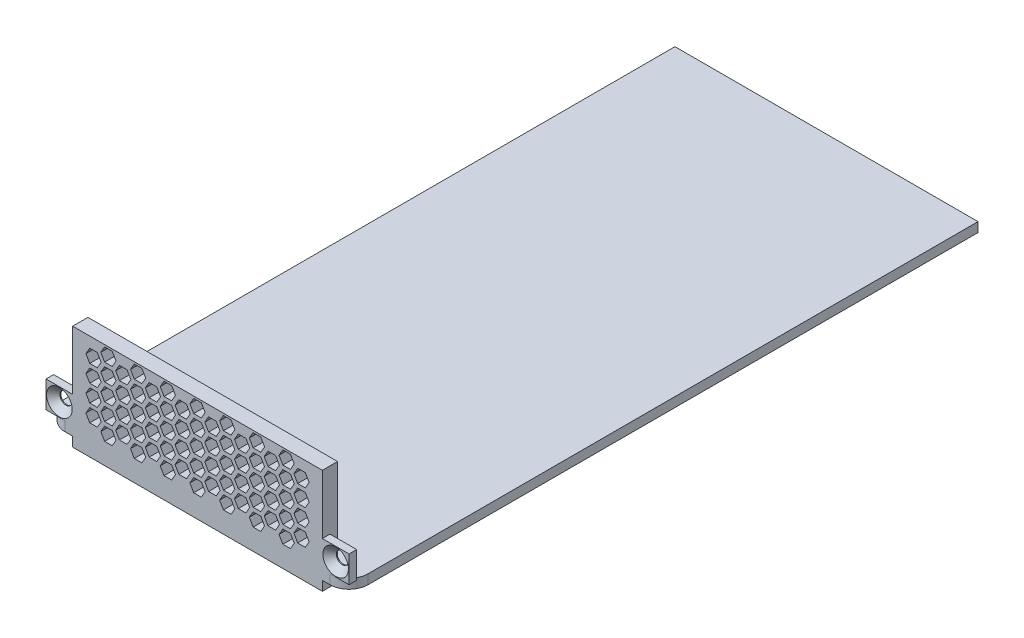
from build123d import *

# Parameters (mm, degrees)
BOSS_EXTRUDE1_DEPTH                                  = 165
FILLET1_R                                            = 5
SKETCH3_W                                            = 65.5
SKETCH3_H                                            = 22.5
BOSS_EXTRUDE2_DEPTH                                  = 4
FILL_START                                           = -4
FILL_PATTERN1_DEPTH                                  = 4
SKETCH4_W                                            = 10
SKETCH4_H                                            = 5
BOSS_EXTRUDE3_DEPTH                                  = 2
SKETCH7_W                                            = 7
SKETCH7_H                                            = 7
BOSS_EXTRUDE4_DEPTH                                  = 2
SKETCH9_W                                            = 7
SKETCH9_H                                            = 7
BOSS_EXTRUDE5_DEPTH                                  = 2
CSK_FOR_M3_HEX_SOCKET_COUNTERSUNK_CAP_SC_D           = 3.2
CSK_FOR_M3_HEX_SOCKET_COUNTERSUNK_CAP_SC_DEPTH       = 5.03862301
CSK_FOR_M3_HEX_SOCKET_COUNTERSUNK_CAP_SC_CSINK_D     = 6.72
CSK_FOR_M3_HEX_SOCKET_COUNTERSUNK_CAP_SC_CSINK_ANGLE = 90
CSK_FOR_M3_HEX_SOCKET_COUNTERSUNK_CAP_SC_TIP         = 0.96137699


# Read off the part's stored shape, not the designer's step: Fill Pattern1
with BuildPart() as part:
    # Sketch1 → Boss-Extrude1 (new body)
    with BuildSketch(Plane.XY):
        Polygon((-39.75, 0), (39.75, 0), (39.75, -2.5), (32.75, -2.5), (32.75, -5), (-32.75, -5), (-32.75, -2.5), (-39.75, -2.5), align=None)
    extrude(amount=-BOSS_EXTRUDE1_DEPTH)

    # Fillet1
    fillet1_edges = [part.edges().sort_by_distance(p)[0] for p in [
        (-39.75, -1.25, 0),
        (39.75, -1.25, 0),
    ]]
    fillet(fillet1_edges, radius=FILLET1_R)

    # Sketch4 → Boss-Extrude3 (add)
    with BuildSketch(Plane.XZ.offset(5)):
        with Locations((0, -7.5)):
            Rectangle(SKETCH4_W, SKETCH4_H)
    extrude(amount=BOSS_EXTRUDE3_DEPTH)



with BuildPart() as body_2:
    # Sketch3 → Boss-Extrude2 (new body)
    with BuildSketch(Plane.XY):
        with Locations((0, 11.25)):
            Rectangle(SKETCH3_W, SKETCH3_H)
    extrude(amount=-BOSS_EXTRUDE2_DEPTH)

    # Fill Pattern1 outline → Fill Pattern1 (cut)
    with BuildSketch(Plane.XY.offset(FILL_START)):
        Polygon((-24.382685902, 3.982050808), (-25.382685902, 2.25), (-24.382685902, 0.517949192), (-22.382685902, 0.517949192), (-21.382685902, 2.25), (-22.382685902, 3.982050808), align=None)
        Polygon((-20.485571585, 10.732050808), (-21.485571585, 9), (-20.485571585, 7.267949192), (-18.485571585, 7.267949192), (-17.485571585, 9), (-18.485571585, 10.732050808), align=None)
        Polygon((-16.588457268, 17.482050808), (-17.588457268, 15.75), (-16.588457268, 14.017949192), (-14.588457268, 14.017949192), (-13.588457268, 15.75), (-14.588457268, 17.482050808), align=None)
        Polygon((-14.588457268, 3.982050808), (-16.588457268, 3.982050808), (-17.588457268, 2.25), (-16.588457268, 0.517949192), (-14.588457268, 0.517949192), (-13.588457268, 2.25), align=None)
        Polygon((-6.794228634, 3.982050808), (-8.794228634, 3.982050808), (-9.794228634, 2.25), (-8.794228634, 0.517949192), (-6.794228634, 0.517949192), (-5.794228634, 2.25), align=None)
        Polygon((1, 3.982050808), (-1, 3.982050808), (-2, 2.25), (-1, 0.517949192), (1, 0.517949192), (2, 2.25), align=None)
        Polygon((8.794228634, 3.982050808), (6.794228634, 3.982050808), (5.794228634, 2.25), (6.794228634, 0.517949192), (8.794228634, 0.517949192), (9.794228634, 2.25), align=None)
        Polygon((24.382685902, 3.982050808), (22.382685902, 3.982050808), (21.382685902, 2.25), (22.382685902, 0.517949192), (24.382685902, 0.517949192), (25.382685902, 2.25), align=None)
        Polygon((16.588457268, 3.982050808), (14.588457268, 3.982050808), (13.588457268, 2.25), (14.588457268, 0.517949192), (16.588457268, 0.517949192), (17.588457268, 2.25), align=None)
        Polygon((-25.279800219, 9), (-26.279800219, 10.732050808), (-28.279800219, 10.732050808), (-29.279800219, 9), (-28.279800219, 7.267949192), (-26.279800219, 7.267949192), align=None)
        Polygon((-8.794228634, 21.982050808), (-9.794228634, 20.25), (-8.794228634, 18.517949192), (-6.794228634, 18.517949192), (-5.794228634, 20.25), (-6.794228634, 21.982050808), align=None)
        Polygon((-16.588457268, 8.482050808), (-17.588457268, 6.75), (-16.588457268, 5.017949192), (-14.588457268, 5.017949192), (-13.588457268, 6.75), (-14.588457268, 8.482050808), align=None)
        Polygon((-12.691342951, 15.232050808), (-13.691342951, 13.5), (-12.691342951, 11.767949192), (-10.691342951, 11.767949192), (-9.691342951, 13.5), (-10.691342951, 15.232050808), align=None)
        Polygon((-14.588457268, 21.982050808), (-16.588457268, 21.982050808), (-17.588457268, 20.25), (-16.588457268, 18.517949192), (-14.588457268, 18.517949192), (-13.588457268, 20.25), align=None)
        Polygon((24.382685902, 21.982050808), (22.382685902, 21.982050808), (21.382685902, 20.25), (22.382685902, 18.517949192), (24.382685902, 18.517949192), (25.382685902, 20.25), align=None)
        Polygon((8.794228634, 21.982050808), (6.794228634, 21.982050808), (5.794228634, 20.25), (6.794228634, 18.517949192), (8.794228634, 18.517949192), (9.794228634, 20.25), align=None)
        Polygon((1, 21.982050808), (-1, 21.982050808), (-2, 20.25), (-1, 18.517949192), (1, 18.517949192), (2, 20.25), align=None)
        Polygon((-22.382685902, 21.982050808), (-24.382685902, 21.982050808), (-25.382685902, 20.25), (-24.382685902, 18.517949192), (-22.382685902, 18.517949192), (-21.382685902, 20.25), align=None)
        Polygon((16.588457268, 21.982050808), (14.588457268, 21.982050808), (13.588457268, 20.25), (14.588457268, 18.517949192), (16.588457268, 18.517949192), (17.588457268, 20.25), align=None)
        Polygon((2, 6.75), (1, 8.482050808), (-1, 8.482050808), (-2, 6.75), (-1, 5.017949192), (1, 5.017949192), align=None)
        Polygon((-1.897114317, 13.5), (-2.897114317, 15.232050808), (-4.897114317, 15.232050808), (-5.897114317, 13.5), (-4.897114317, 11.767949192), (-2.897114317, 11.767949192), align=None)
        Polygon((-24.382685902, 8.482050808), (-25.382685902, 6.75), (-24.382685902, 5.017949192), (-22.382685902, 5.017949192), (-21.382685902, 6.75), (-22.382685902, 8.482050808), align=None)
        Polygon((-20.485571585, 15.232050808), (-21.485571585, 13.5), (-20.485571585, 11.767949192), (-18.485571585, 11.767949192), (-17.485571585, 13.5), (-18.485571585, 15.232050808), align=None)
        Polygon((-5.794228634, 6.75), (-6.794228634, 8.482050808), (-8.794228634, 8.482050808), (-9.794228634, 6.75), (-8.794228634, 5.017949192), (-6.794228634, 5.017949192), align=None)
        Polygon((18.485571585, 15.232050808), (17.485571585, 13.5), (18.485571585, 11.767949192), (20.485571585, 11.767949192), (21.485571585, 13.5), (20.485571585, 15.232050808), align=None)
        Polygon((14.588457268, 8.482050808), (13.588457268, 6.75), (14.588457268, 5.017949192), (16.588457268, 5.017949192), (17.588457268, 6.75), (16.588457268, 8.482050808), align=None)
        Polygon((29.279800219, 13.5), (28.279800219, 15.232050808), (26.279800219, 15.232050808), (25.279800219, 13.5), (26.279800219, 11.767949192), (28.279800219, 11.767949192), align=None)
        Polygon((24.382685902, 8.482050808), (22.382685902, 8.482050808), (21.382685902, 6.75), (22.382685902, 5.017949192), (24.382685902, 5.017949192), (25.382685902, 6.75), align=None)
        Polygon((8.794228634, 8.482050808), (6.794228634, 8.482050808), (5.794228634, 6.75), (6.794228634, 5.017949192), (8.794228634, 5.017949192), (9.794228634, 6.75), align=None)
        Polygon((-25.279800219, 13.5), (-26.279800219, 15.232050808), (-28.279800219, 15.232050808), (-29.279800219, 13.5), (-28.279800219, 11.767949192), (-26.279800219, 11.767949192), align=None)
        Polygon((22.382685902, 17.482050808), (21.382685902, 15.75), (22.382685902, 14.017949192), (24.382685902, 14.017949192), (25.382685902, 15.75), (24.382685902, 17.482050808), align=None)
        Polygon((18.485571585, 10.732050808), (17.485571585, 9), (18.485571585, 7.267949192), (20.485571585, 7.267949192), (21.485571585, 9), (20.485571585, 10.732050808), align=None)
        Polygon((-22.382685902, 17.482050808), (-24.382685902, 17.482050808), (-25.382685902, 15.75), (-24.382685902, 14.017949192), (-22.382685902, 14.017949192), (-21.382685902, 15.75), align=None)
        Polygon((-6.794228634, 17.482050808), (-8.794228634, 17.482050808), (-9.794228634, 15.75), (-8.794228634, 14.017949192), (-6.794228634, 14.017949192), (-5.794228634, 15.75), align=None)
        Polygon((8.794228634, 17.482050808), (6.794228634, 17.482050808), (5.794228634, 15.75), (6.794228634, 14.017949192), (8.794228634, 14.017949192), (9.794228634, 15.75), align=None)
        Polygon((1, 17.482050808), (-1, 17.482050808), (-2, 15.75), (-1, 14.017949192), (1, 14.017949192), (2, 15.75), align=None)
        Polygon((16.588457268, 17.482050808), (14.588457268, 17.482050808), (13.588457268, 15.75), (14.588457268, 14.017949192), (16.588457268, 14.017949192), (17.588457268, 15.75), align=None)
        Polygon((29.279800219, 9), (28.279800219, 10.732050808), (26.279800219, 10.732050808), (25.279800219, 9), (26.279800219, 7.267949192), (28.279800219, 7.267949192), align=None)
        Polygon((22.382685902, 12.982050808), (21.382685902, 11.25), (22.382685902, 9.517949192), (24.382685902, 9.517949192), (25.382685902, 11.25), (24.382685902, 12.982050808), align=None)
        Polygon((18.485571585, 6.232050808), (17.485571585, 4.5), (18.485571585, 2.767949192), (20.485571585, 2.767949192), (21.485571585, 4.5), (20.485571585, 6.232050808), align=None)
        Polygon((26.279800219, 19.732050808), (25.279800219, 18), (26.279800219, 16.267949192), (28.279800219, 16.267949192), (29.279800219, 18), (28.279800219, 19.732050808), align=None)
        Polygon((16.588457268, 12.982050808), (14.588457268, 12.982050808), (13.588457268, 11.25), (14.588457268, 9.517949192), (16.588457268, 9.517949192), (17.588457268, 11.25), align=None)
        Polygon((-22.382685902, 12.982050808), (-24.382685902, 12.982050808), (-25.382685902, 11.25), (-24.382685902, 9.517949192), (-22.382685902, 9.517949192), (-21.382685902, 11.25), align=None)
        Polygon((8.794228634, 12.982050808), (6.794228634, 12.982050808), (5.794228634, 11.25), (6.794228634, 9.517949192), (8.794228634, 9.517949192), (9.794228634, 11.25), align=None)
        Polygon((1, 12.982050808), (-1, 12.982050808), (-2, 11.25), (-1, 9.517949192), (1, 9.517949192), (2, 11.25), align=None)
        Polygon((-6.794228634, 12.982050808), (-8.794228634, 12.982050808), (-9.794228634, 11.25), (-8.794228634, 9.517949192), (-6.794228634, 9.517949192), (-5.794228634, 11.25), align=None)
        Polygon((-14.588457268, 12.982050808), (-16.588457268, 12.982050808), (-17.588457268, 11.25), (-16.588457268, 9.517949192), (-14.588457268, 9.517949192), (-13.588457268, 11.25), align=None)
        Polygon((21.485571585, 18), (20.485571585, 19.732050808), (18.485571585, 19.732050808), (17.485571585, 18), (18.485571585, 16.267949192), (20.485571585, 16.267949192), align=None)
        Polygon((29.279800219, 4.5), (28.279800219, 6.232050808), (26.279800219, 6.232050808), (25.279800219, 4.5), (26.279800219, 2.767949192), (28.279800219, 2.767949192), align=None)
        Polygon((12.691342951, 6.232050808), (10.691342951, 6.232050808), (9.691342951, 4.5), (10.691342951, 2.767949192), (12.691342951, 2.767949192), (13.691342951, 4.5), align=None)
        Polygon((4.897114317, 6.232050808), (2.897114317, 6.232050808), (1.897114317, 4.5), (2.897114317, 2.767949192), (4.897114317, 2.767949192), (5.897114317, 4.5), align=None)
        Polygon((-2.897114317, 6.232050808), (-4.897114317, 6.232050808), (-5.897114317, 4.5), (-4.897114317, 2.767949192), (-2.897114317, 2.767949192), (-1.897114317, 4.5), align=None)
        Polygon((-10.691342951, 6.232050808), (-12.691342951, 6.232050808), (-13.691342951, 4.5), (-12.691342951, 2.767949192), (-10.691342951, 2.767949192), (-9.691342951, 4.5), align=None)
        Polygon((-18.485571585, 6.232050808), (-20.485571585, 6.232050808), (-21.485571585, 4.5), (-20.485571585, 2.767949192), (-18.485571585, 2.767949192), (-17.485571585, 4.5), align=None)
        Polygon((-26.279800219, 6.232050808), (-28.279800219, 6.232050808), (-29.279800219, 4.5), (-28.279800219, 2.767949192), (-26.279800219, 2.767949192), (-25.279800219, 4.5), align=None)
        Polygon((13.691342951, 18), (12.691342951, 19.732050808), (10.691342951, 19.732050808), (9.691342951, 18), (10.691342951, 16.267949192), (12.691342951, 16.267949192), align=None)
        Polygon((12.691342951, 10.732050808), (10.691342951, 10.732050808), (9.691342951, 9), (10.691342951, 7.267949192), (12.691342951, 7.267949192), (13.691342951, 9), align=None)
        Polygon((4.897114317, 10.732050808), (2.897114317, 10.732050808), (1.897114317, 9), (2.897114317, 7.267949192), (4.897114317, 7.267949192), (5.897114317, 9), align=None)
        Polygon((-2.897114317, 10.732050808), (-4.897114317, 10.732050808), (-5.897114317, 9), (-4.897114317, 7.267949192), (-2.897114317, 7.267949192), (-1.897114317, 9), align=None)
        Polygon((-10.691342951, 10.732050808), (-12.691342951, 10.732050808), (-13.691342951, 9), (-12.691342951, 7.267949192), (-10.691342951, 7.267949192), (-9.691342951, 9), align=None)
        Polygon((-10.691342951, 19.732050808), (-12.691342951, 19.732050808), (-13.691342951, 18), (-12.691342951, 16.267949192), (-10.691342951, 16.267949192), (-9.691342951, 18), align=None)
        Polygon((-2.897114317, 19.732050808), (-4.897114317, 19.732050808), (-5.897114317, 18), (-4.897114317, 16.267949192), (-2.897114317, 16.267949192), (-1.897114317, 18), align=None)
        Polygon((-18.485571585, 19.732050808), (-20.485571585, 19.732050808), (-21.485571585, 18), (-20.485571585, 16.267949192), (-18.485571585, 16.267949192), (-17.485571585, 18), align=None)
        Polygon((-26.279800219, 19.732050808), (-28.279800219, 19.732050808), (-29.279800219, 18), (-28.279800219, 16.267949192), (-26.279800219, 16.267949192), (-25.279800219, 18), align=None)
        Polygon((4.897114317, 19.732050808), (2.897114317, 19.732050808), (1.897114317, 18), (2.897114317, 16.267949192), (4.897114317, 16.267949192), (5.897114317, 18), align=None)
        Polygon((4.897114317, 15.232050808), (2.897114317, 15.232050808), (1.897114317, 13.5), (2.897114317, 11.767949192), (4.897114317, 11.767949192), (5.897114317, 13.5), align=None)
        Polygon((12.691342951, 15.232050808), (10.691342951, 15.232050808), (9.691342951, 13.5), (10.691342951, 11.767949192), (12.691342951, 11.767949192), (13.691342951, 13.5), align=None)
    extrude(amount=FILL_PATTERN1_DEPTH, mode=Mode.SUBTRACT)


with BuildPart() as part_1:
    add(part.part)

    add(body_2.part)  # Boss-Extrude4 merges body 2
    # Sketch7 → Boss-Extrude4 (add)
    with BuildSketch(Plane.XY):
        with Locations((36.25, 3.5)):
            Rectangle(SKETCH7_W, SKETCH7_H)
    extrude(amount=-BOSS_EXTRUDE4_DEPTH)

    # Sketch9 → Boss-Extrude5 (add)
    with BuildSketch(Plane.XY):
        with Locations((-36.25, 3.5)):
            Rectangle(SKETCH9_W, SKETCH9_H)
    extrude(amount=-BOSS_EXTRUDE5_DEPTH)

    # CSK for M3 Hex Socket Countersunk Cap Screw1
    with Locations(Plane.XY):
        with Locations((-36.25, 3.5), (36.25, 3.5)):
            CounterSinkHole(CSK_FOR_M3_HEX_SOCKET_COUNTERSUNK_CAP_SC_D / 2, CSK_FOR_M3_HEX_SOCKET_COUNTERSUNK_CAP_SC_CSINK_D / 2, depth=CSK_FOR_M3_HEX_SOCKET_COUNTERSUNK_CAP_SC_DEPTH, counter_sink_angle=CSK_FOR_M3_HEX_SOCKET_COUNTERSUNK_CAP_SC_CSINK_ANGLE)
            with Locations((0, 0, -(CSK_FOR_M3_HEX_SOCKET_COUNTERSUNK_CAP_SC_DEPTH + CSK_FOR_M3_HEX_SOCKET_COUNTERSUNK_CAP_SC_TIP / 2))):  # 118° drill point
                Cone(0, CSK_FOR_M3_HEX_SOCKET_COUNTERSUNK_CAP_SC_D / 2, CSK_FOR_M3_HEX_SOCKET_COUNTERSUNK_CAP_SC_TIP, mode=Mode.SUBTRACT)


solid = part_1.part
